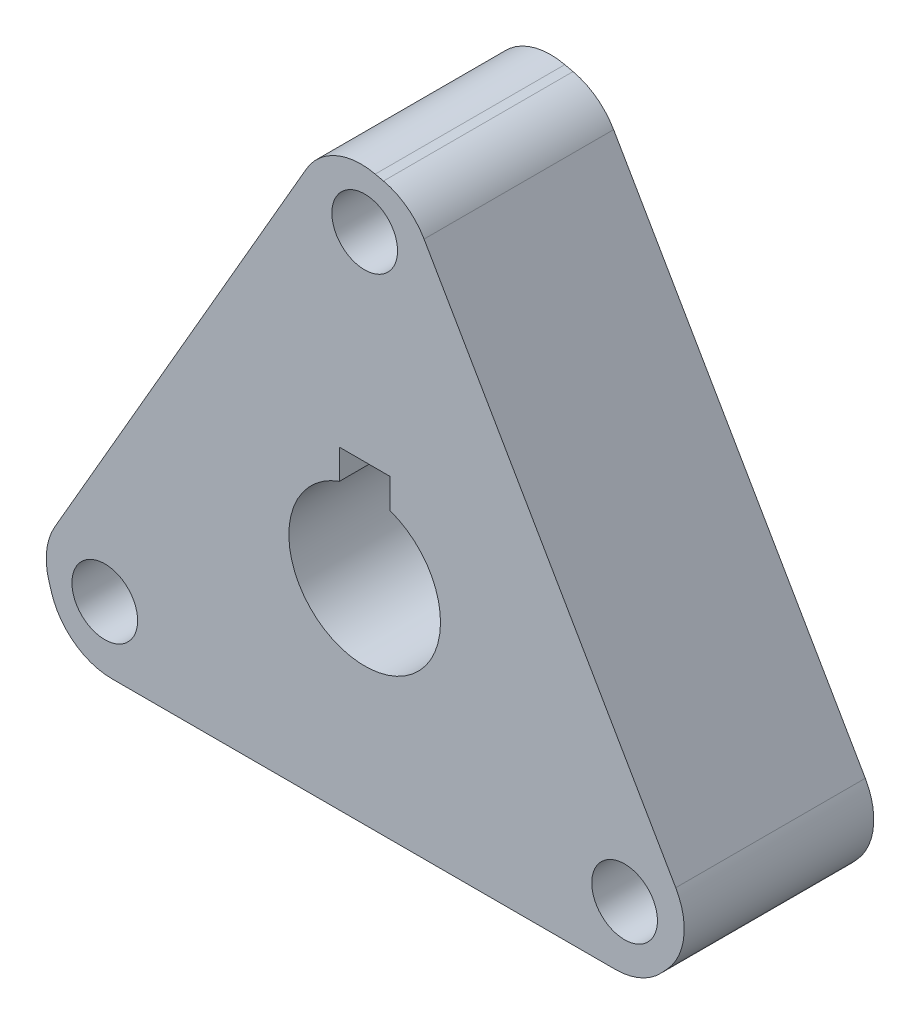
from build123d import *

# Parameters (mm, degrees)
SKETCH_1_R          = 2.6
EXTRUDE_1_DEPTH     = 15
CUT_EXTRUDE_1_REACH = 55.865
SKETCH_3_R          = 1.5
SKETCH_4_R          = 3.1
CUT_EXTRUDE_2_DEPTH = 3
CUT_EXTRUDE_3_DEPTH = 10


with BuildPart() as part:
    # ｽｹｯﾁ1 → ﾎﾞｽ - 押し出し1 (new body)
    with BuildSketch(Plane.XY):
        with BuildLine():
            ThreePointArc((0.836521252, 28.13264673), (-2.279272258, 27.84387272), (-4.613248654, 25.759618943))
            Line((-4.613248654, 25.759618943), (-24.528506183, -8.734618943))
            ThreePointArc((-24.528506183, -8.734618943), (-25.166534704, -10.671209204), (-24.978366464, -12.701493653))
            Line((-24.978366464, -12.701493653), (-24.781847369, -13.34187471))
            ThreePointArc((-24.781847369, -13.34187471), (-22.973864986, -15.895844038), (-20.00186007, -16.875))
            Line((-20.00186007, -16.875), (19.828654989, -16.875))
            ThreePointArc((19.828654989, -16.875), (21.824805612, -16.459253777), (23.488999402, -15.281153076))
            Line((23.488999402, -15.281153076), (23.945326118, -14.790772019))
            ThreePointArc((23.945326118, -14.790772019), (25.253137244, -11.948028682), (24.615108724, -8.884618943))
            Line((24.615108724, -8.884618943), (4.699851194, 25.609618943))
            ThreePointArc((4.699851194, 25.609618943), (3.341729092, 27.130462981), (1.489367062, 27.98264673))
            Line((1.489367062, 27.98264673), (0.836521252, 28.13264673))
        make_face()
        with Locations((-20.56810334, -11.875)):
            Circle(SKETCH_1_R, mode=Mode.SUBTRACT)
        with BuildLine():
            ThreePointArc((6, 0), (-3.464101615, -4.898979486), (-2, 5.656854249))
            Line((-2, 5.656854249), (-2, 8))
            Line((-2, 8), (2, 8))
            Line((2, 8), (2, 5.656854249))
            ThreePointArc((2, 5.656854249), (4.898979486, 3.464101615), (6, 0))
        make_face(mode=Mode.SUBTRACT)
        with Locations((20.56810334, -11.875)):
            Circle(SKETCH_1_R, mode=Mode.SUBTRACT)
        with Locations((0, 23.75)):
            Circle(SKETCH_1_R, mode=Mode.SUBTRACT)
    extrude(amount=EXTRUDE_1_DEPTH)

    # ｽｹｯﾁ3 → ｶｯﾄ - 押し出し1 (cut, up to next)
    with BuildSketch(Plane.XZ.offset(16.875), mode=Mode.PRIVATE) as cut_extrude_1_sk1:
        with Locations((0, 5)):
            Circle(SKETCH_3_R)
    cut_extrude_1_tool1 = extrude(cut_extrude_1_sk1.sketch, amount=-CUT_EXTRUDE_1_REACH, mode=Mode.PRIVATE) & part.part
    add(cut_extrude_1_tool1.solids().sort_by_distance((0, -16.875, 5))[0], mode=Mode.SUBTRACT)

    # ｽｹｯﾁ4 → ｶｯﾄ - 押し出し2 (cut)
    with BuildSketch(Plane.XZ.offset(16.875)):
        with Locations((0, 5)):
            Circle(SKETCH_4_R)
    extrude(amount=-CUT_EXTRUDE_2_DEPTH, mode=Mode.SUBTRACT)

    # ｽｹｯﾁ5 → ｶｯﾄ - 押し出し3 (cut)
    with BuildSketch(Plane(origin=(0, 0, 0), x_dir=(-1, 0, 0), z_dir=(0, 0, -1))):
        with BuildLine():
            ThreePointArc((1.934009748, 16.400196853), (0, 16.15), (-1.934009748, 16.400196853))
            Line((-1.934009748, 16.400196853), (-6.128966865, 9.134317991))
            ThreePointArc((-6.128966865, 9.134317991), (0, 11), (6.128966865, 9.134317991))
            Line((6.128966865, 9.134317991), (1.934009748, 16.400196853))
        make_face()
        with BuildLine():
            ThreePointArc((-4.846067994, -9.875), (-9.526279442, -5.5), (-10.975034859, 0.740682009))
            Line((-10.975034859, 0.740682009), (-15.169991976, -6.525196853))
            ThreePointArc((-15.169991976, -6.525196853), (-13.986310271, -8.075), (-13.235982228, -9.875))
            Line((-13.235982228, -9.875), (-4.846067994, -9.875))
        make_face()
        with BuildLine():
            Line((15.169991976, -6.525196853), (10.975034859, 0.740682009))
            ThreePointArc((10.975034859, 0.740682009), (9.526279442, -5.5), (4.846067994, -9.875))
            Line((4.846067994, -9.875), (13.235982228, -9.875))
            ThreePointArc((13.235982228, -9.875), (13.986310271, -8.075), (15.169991976, -6.525196853))
        make_face()
    extrude(amount=-CUT_EXTRUDE_3_DEPTH, mode=Mode.SUBTRACT)


solid = part.part
